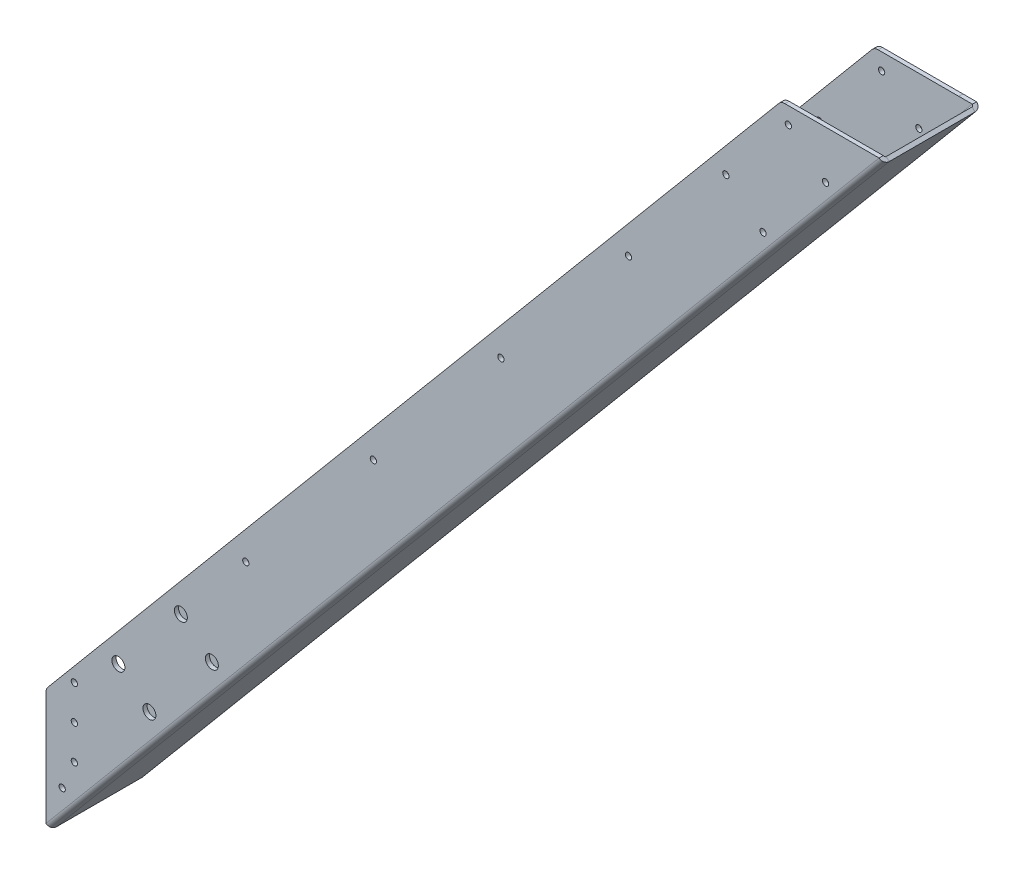
from build123d import *

# Parameters (mm, degrees)
BASE_FLANGE1_DEPTH           = 3.2639
EDGE_FLANGE1_DEPTH           = 1016
EDGE_FLANGE2_DEPTH           = 1016
BOSS_EXTRUDE1_DEPTH          = 3.2639
CUT_EXTRUDE1_DEPTH           = 3.2639
F_10_0_1935_DIAMETER_HOLE1_D = 4.9149
LPATTERN1_COUNT              = 4
LPATTERN1_PITCH              = 155.575
F_3_8_0_4_DOWEL_HOLE1_D      = 10.16
F_10_0_1935_DIAMETER_HOLE2_D = 4.9149
F_10_0_1935_DIAMETER_HOLE3_D = 4.9149
FILLET1_R                    = 6.35


# Sheet-metal steps are written as plain solids
with BuildPart() as part:
    # Sketch1 → Base-Flange1 (new body)
    with BuildSketch(Plane.XY):
        Polygon((0, 0), (653.072211442, 778.301154209), (576.30897854, 778.301154209), (0, 91.482858589), align=None)
    extrude(amount=-BASE_FLANGE1_DEPTH)

    # Edge-Flange1 section (across the edge) → Edge-Flange1 (add)
    with BuildSketch(Plane(origin=(654.045087884, 777.484813945, -3.2639), x_dir=(-0.7660444431189772, 0.6427876096865405, -3.4914813388431334e-15), z_dir=(-0.6427876096865405, -0.7660444431189772, 0))):
        with BuildLine():
            Line((-3.2639, 1.27), (-3.2639, 68.58))
            Line((-3.2639, 68.58), (0, 68.58))
            Line((0, 68.58), (0, 1.27))
            ThreePointArc((0, 1.27), (0.371974388, 0.371974388), (1.27, 0))
            Line((1.27, 0), (1.27, -3.2639))
            ThreePointArc((1.27, -3.2639), (-1.935951435, -1.935951435), (-3.2639, 1.27))
        make_face()
    extrude(amount=EDGE_FLANGE1_DEPTH)

    # Edge-Flange2 section (across the edge) → Edge-Flange2 (add)
    with BuildSketch(Plane(origin=(654.045087884, 777.484813945, -73.1139), x_dir=(0, 0, 1), z_dir=(-0.6427876096865404, -0.7660444431189771, 0))):
        with BuildLine():
            Line((-3.2639, 1.27), (-3.2639, 9.4361))
            Line((-3.2639, 9.4361), (0, 9.4361))
            Line((0, 9.4361), (0, 1.27))
            ThreePointArc((0, 1.27), (0.371974388, 0.371974388), (1.27, 0))
            Line((1.27, 0), (1.27, -3.2639))
            ThreePointArc((1.27, -3.2639), (-1.935951435, -1.935951435), (-3.2639, 1.27))
        make_face()
    extrude(amount=EDGE_FLANGE2_DEPTH)

    # Sketch12 → Boss-Extrude1 (add)
    with BuildSketch(Plane(origin=(0, 0, -76.3778), x_dir=(-1, 0, 0), z_dir=(0, 0, -1))):
        Polygon((-576.30897854, 778.301154209), (-653.072211442, 778.301154209), (0, 0), (0, 91.482858589), align=None)
    extrude(amount=-BOSS_EXTRUDE1_DEPTH)

    # Sketch13 → Cut-Extrude1 (cut)
    with BuildSketch(Plane(origin=(0, 0, -76.3778), x_dir=(-1, 0, 0), z_dir=(0, 0, -1))):
        Polygon((-646.816615915, 783.550222108), (-653.072211442, 778.301154209), (-642.412124976, 778.301154209), align=None)
        Polygon((0, 12.704196343), (0, 0), (6.255595527, 5.249067899), align=None)
    extrude(amount=-CUT_EXTRUDE1_DEPTH, mode=Mode.SUBTRACT)

    # #10 (0.1935) Diameter Hole1 (through all)
    with Locations(Plane.XY):
        with Locations((456.639396233, 613.457095394)):
            f_10_0_1935_diameter_hole1 = Hole(F_10_0_1935_DIAMETER_HOLE1_D / 2)

    # LPattern1: #10 (0.1935) Diameter Hole1 ×4
    with Locations(*[Vector(-0.6427876096865404, -0.7660444431189771, 0) * (i * LPATTERN1_PITCH) for i in range(1, LPATTERN1_COUNT)]):
        add(f_10_0_1935_diameter_hole1, mode=Mode.SUBTRACT)

    # 3/8 (0.4) Dowel Hole1 (through all)
    with Locations(Plane.XY):
        with Locations((56.751746801, 136.647718392), (81.073657871, 116.239211785), (130.054073729, 174.611798351), (105.73216266, 195.020304958)):
            Hole(F_3_8_0_4_DOWEL_HOLE1_D / 2)

    # #10 (0.1935) Diameter Hole2 (through all)
    with Locations(Plane.XY):
        with Locations((12.7, 30.488995291), (22.225, 52.713995291), (22.225, 79.701495291), (22.225, 106.688995291)):
            Hole(F_10_0_1935_DIAMETER_HOLE2_D / 2)

    # #10 (0.1935) Diameter Hole3 (through all)
    with Locations(Plane.XY):
        with Locations((581.956041646, 765.273369352), (532.975625788, 706.900782786), (562.161919071, 682.410574857), (611.142334929, 740.783161423)):
            Hole(F_10_0_1935_DIAMETER_HOLE3_D / 2)

    # Fillet1
    fillet1_edges = [part.edges().sort_by_distance(p)[0] for p in [
        (0, 91.482858589, -74.74585),
        (576.30897854, 778.301154209, -74.74585),
        (0, 91.482858589, -1.63195),
        (576.30897854, 778.301154209, -1.63195),
    ]]
    fillet(fillet1_edges, radius=FILLET1_R)


solid = part.part
